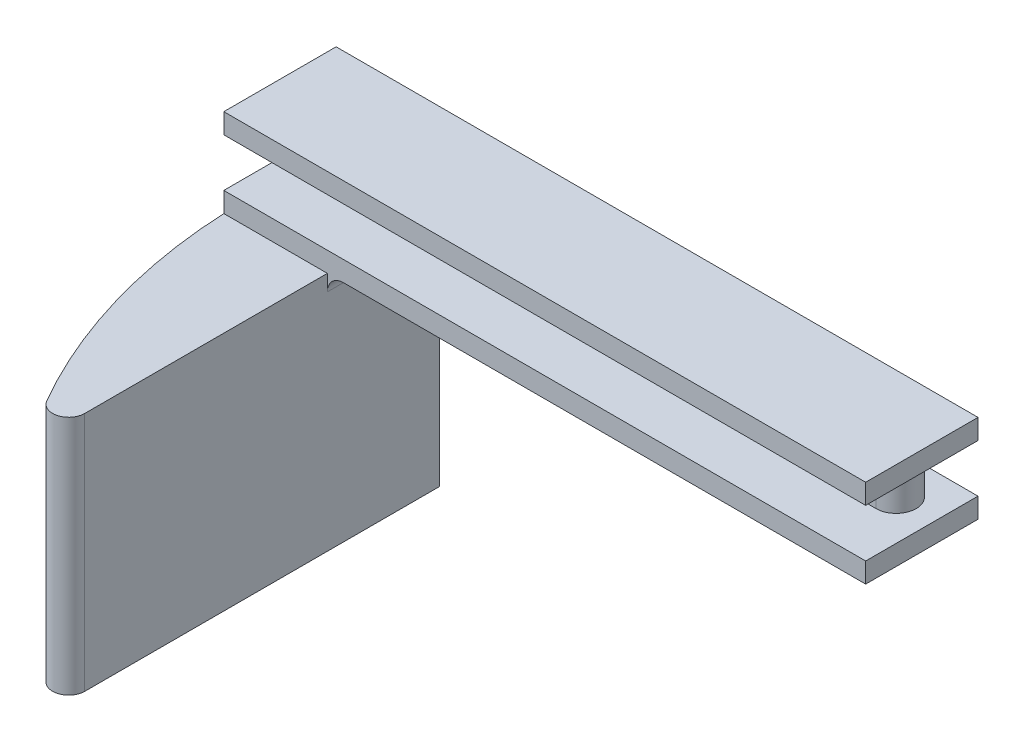
from build123d import *

# Parameters (mm, degrees)
SKETCH2_W           = 101.6
SKETCH2_H           = 17.78
BOSS_EXTRUDE1_DEPTH = 3.175
BOSS_EXTRUDE2_DEPTH = 7.62
BOSS_EXTRUDE3_DEPTH = 38.1
FILLET1_R           = 2.54
FILLET2_R           = 2.54


with BuildPart() as part:
    # Sketch2 → Boss-Extrude1 (new body)
    with BuildSketch(Plane(origin=(0, 0, 0), x_dir=(1, 0, 0), z_dir=(0, 1, 0))):
        with Locations((50.8, 8.89)):
            Rectangle(SKETCH2_W, SKETCH2_H)
    boss_extrude1 = extrude(amount=BOSS_EXTRUDE1_DEPTH)

    # Sketch3 → Boss-Extrude2 (add)
    with BuildSketch(Plane.XZ):
        with BuildLine():
            Line((95.25, -14.351), (6.35, -14.351))
            ThreePointArc((6.35, -14.351), (3.175, -11.176), (6.35, -8.001))
            Line((6.35, -8.001), (95.25, -8.001))
            ThreePointArc((95.25, -8.001), (98.425, -11.176), (95.25, -14.351))
        make_face()
    extrude(amount=BOSS_EXTRUDE2_DEPTH)

    # Mirror1: Boss-Extrude1 across plane
    add(boss_extrude1.mirror(Plane(origin=(0, -3.81, 0), x_dir=(0, 0, 1), z_dir=(0, -1, 0))))

    # Sketch4 → Boss-Extrude3 (add)
    with BuildSketch(Plane.XZ.offset(10.795)):
        with BuildLine():
            Line((0, -17.78), (16.393849753, -17.78))
            Line((16.393849753, -17.78), (16.393849753, 0))
            Line((16.393849753, 0), (16.393849753, 47.008966697))
            ThreePointArc((16.393849753, 47.008966697), (4.7870119, 24.693652244), (0, 0))
            Line((0, 0), (0, -17.78))
        make_face()
    extrude(amount=BOSS_EXTRUDE3_DEPTH)

    # Fillet1
    fillet1_edges = [part.edges().sort_by_distance(p)[0] for p in [
        (16.393849753, -10.795, -8.89),
    ]]
    fillet(fillet1_edges, radius=FILLET1_R)

    # Fillet2
    fillet2_edges = [part.edges().sort_by_distance(p)[0] for p in [
        (16.393849753, -29.845, 47.008966697),
    ]]
    fillet(fillet2_edges, radius=FILLET2_R)


solid = part.part
